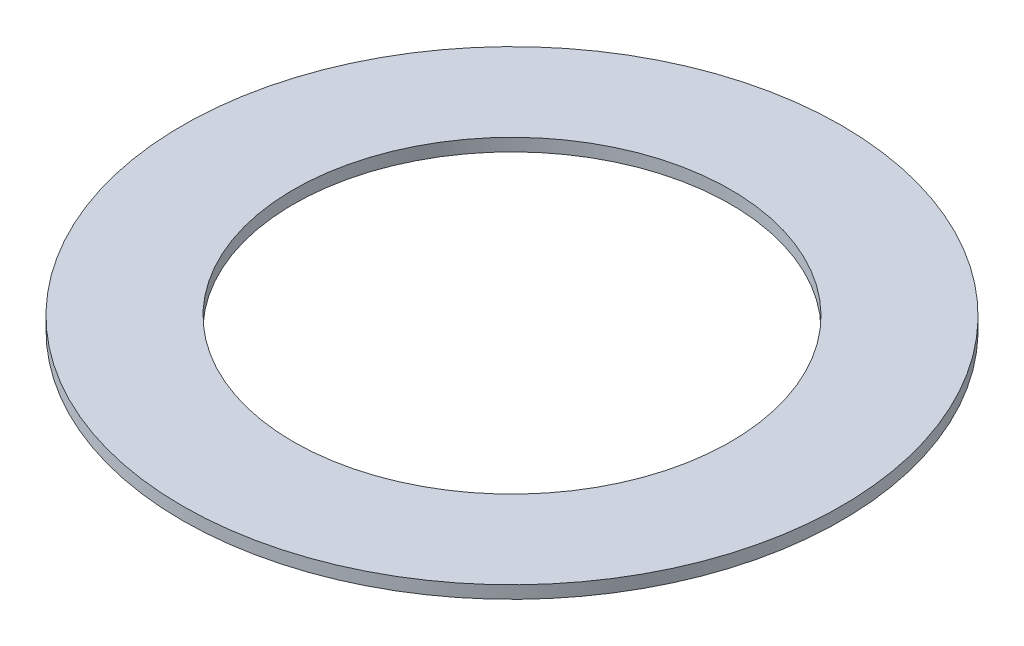
from build123d import *

# Parameters (mm, degrees)
SKETCH1_R           = 78.35
SKETCH1_R_2         = 51.95
BOSS_EXTRUDE1_DEPTH = 3


with BuildPart() as part:
    # Sketch1 → Boss-Extrude1 (new body)
    with BuildSketch(Plane(origin=(0, 0, 0), x_dir=(1, 0, 0), z_dir=(0, 1, 0))):
        Circle(SKETCH1_R)
        Circle(SKETCH1_R_2, mode=Mode.SUBTRACT)
    extrude(amount=BOSS_EXTRUDE1_DEPTH)


solid = part.part
